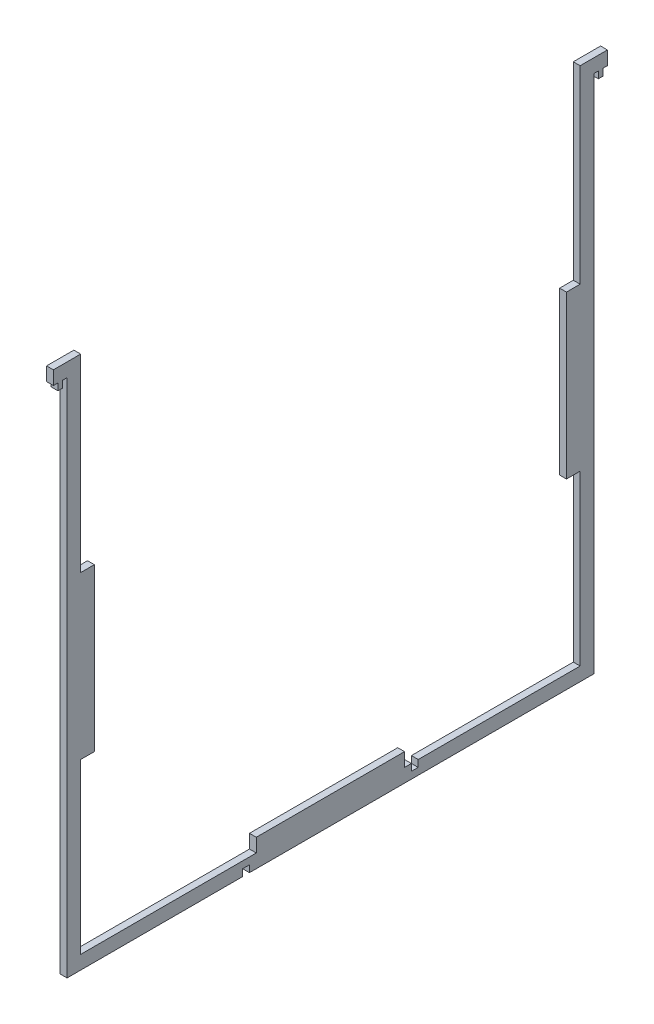
from build123d import *

# Parameters (mm, degrees)
BOSS_EXTRUDE1_DEPTH = 3.175
MIRROR1_OUTLINE_W   = 3.175
MIRROR1_OUTLINE_H   = 6.35
MIRROR1_DEPTH       = 248.225
MIRROR1_2_OUTLINE_W = 3.175
MIRROR1_2_OUTLINE_H = 116.175
MIRROR1_2_DEPTH     = 6.35
MIRROR1_START       = 84.858333333
MIRROR1_3_OUTLINE_W = 3.175
MIRROR1_3_OUTLINE_H = 6.35
MIRROR1_3_DEPTH     = 75.333333334
MIRROR1_START_2     = 6.35
MIRROR1_4_OUTLINE_W = 3.175
MIRROR1_4_OUTLINE_H = 34.491666667
MIRROR1_4_DEPTH     = 6.35
MIRROR1_START_3     = 241.875
MIRROR1_5_OUTLINE_W = 3.175
MIRROR1_5_OUTLINE_H = 6.35
MIRROR1_5_DEPTH     = 6.35
MIRROR1_START_4     = 238.7
MIRROR1_6_OUTLINE_W = 3.175
MIRROR1_6_OUTLINE_H = 2.116666666
MIRROR1_6_DEPTH     = 3.175
SKETCH2_W           = 3.175
SKETCH2_H           = 3.175
CUT_EXTRUDE1_DEPTH  = 3.175


# Read off the part's stored shape, not the designer's step: Mirror1
with BuildPart() as part:
    # Sketch1 → Boss-Extrude1 (new body)
    with BuildSketch(Plane(origin=(0, 0, 0), x_dir=(0, 0, -1), z_dir=(1, 0, 0))):
        Polygon((6.35, 232.35), (0, 232.35), (0, 0), (122.525, 0), (122.525, 12.7), (88.033333333, 12.7), (88.033333333, 6.35), (6.35, 6.35), (6.35, 84.858333333), (12.7, 84.858333333), (12.7, 160.191666667), (6.35, 160.191666667), align=None)
        Polygon((-2.116666667, 241.875), (0, 241.875), (0, 232.35), (6.35, 232.35), (6.35, 248.225), (-6.35, 248.225), (-6.35, 241.875), (-4.233333333, 241.875), (-4.233333333, 238.7), (-2.116666667, 238.7), align=None)
    extrude(amount=BOSS_EXTRUDE1_DEPTH)



with BuildPart() as body_2:
    # Mirror1 outline → Mirror1 (new body)
    with BuildSketch(Plane(origin=(0, 0, 0), x_dir=(1, 0, 0), z_dir=(0, 1, 0))):
        with Locations((1.5875, 241.875)):
            Rectangle(MIRROR1_OUTLINE_W, MIRROR1_OUTLINE_H)
    extrude(amount=MIRROR1_DEPTH)


with BuildPart() as part_1:
    add(part.part)

    add(body_2.part)  # Mirror1 2 merges body 2
    # Mirror1 2 outline → Mirror1 2 (add)
    with BuildSketch(Plane(origin=(0, 0, 0), x_dir=(1, 0, 0), z_dir=(0, 1, 0))):
        with Locations((1.5875, 180.6125)):
            Rectangle(MIRROR1_2_OUTLINE_W, MIRROR1_2_OUTLINE_H)
    extrude(amount=MIRROR1_2_DEPTH)

    # Mirror1 3 outline → Mirror1 3 (add)
    with BuildSketch(Plane(origin=(0, 0, 0), x_dir=(1, 0, 0), z_dir=(0, 1, 0)).offset(MIRROR1_START)):
        with Locations((1.5875, 235.525)):
            Rectangle(MIRROR1_3_OUTLINE_W, MIRROR1_3_OUTLINE_H)
    extrude(amount=MIRROR1_3_DEPTH)

    # Mirror1 4 outline → Mirror1 4 (add)
    with BuildSketch(Plane(origin=(0, 0, 0), x_dir=(1, 0, 0), z_dir=(0, 1, 0)).offset(MIRROR1_START_2)):
        with Locations((1.5875, 139.770833334)):
            Rectangle(MIRROR1_4_OUTLINE_W, MIRROR1_4_OUTLINE_H)
    extrude(amount=MIRROR1_4_DEPTH)

    # Mirror1 5 outline → Mirror1 5 (add)
    with BuildSketch(Plane(origin=(0, 0, 0), x_dir=(1, 0, 0), z_dir=(0, 1, 0)).offset(MIRROR1_START_3)):
        with Locations((1.5875, 248.225)):
            Rectangle(MIRROR1_5_OUTLINE_W, MIRROR1_5_OUTLINE_H)
    extrude(amount=MIRROR1_5_DEPTH)

    # Mirror1 6 outline → Mirror1 6 (add)
    with BuildSketch(Plane(origin=(0, 0, 0), x_dir=(1, 0, 0), z_dir=(0, 1, 0)).offset(MIRROR1_START_4)):
        with Locations((1.5875, 248.225)):
            Rectangle(MIRROR1_6_OUTLINE_W, MIRROR1_6_OUTLINE_H)
    extrude(amount=MIRROR1_6_DEPTH)

    # Sketch2 → Cut-Extrude1 (cut)
    with BuildSketch(Plane(origin=(3.175, 0, 0), x_dir=(0, 0, -1), z_dir=(1, 0, 0))):
        with Locations((83.270833333, 1.5875)):
            Rectangle(SKETCH2_W, SKETCH2_H)
        with Locations((161.779166667, 4.7625)):
            Rectangle(SKETCH2_W, SKETCH2_H)
    extrude(amount=-CUT_EXTRUDE1_DEPTH, mode=Mode.SUBTRACT)


solid = part_1.part
